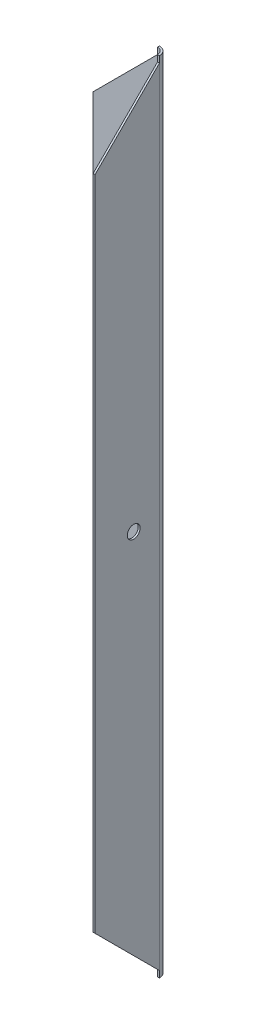
from build123d import *

# Parameters (mm, degrees)
BOSS_EXTRUDE1_DEPTH     = 1.5
BOSS_EXTRUDE3_DEPTH     = 1.5
CUT_EXTRUDE1_DEPTH      = 625.993799969
CUT_EXTRUDE1_DEPTH_BACK = 625.993799969
BOSS_EXTRUDE4_DEPTH     = 620
CUT_EXTRUDE2_DEPTH      = 321.132004023
CUT_EXTRUDE2_DEPTH_BACK = 321.132004023
SKETCH6_R               = 5
CUT_EXTRUDE3_DEPTH      = 320.870676993
CUT_EXTRUDE3_DEPTH_BACK = 320.870676993
SKETCH7_R               = 5


with BuildPart() as part:
    # Sketch1 → Boss-Extrude1 (new body)
    with BuildSketch(Plane(origin=(0, 0, 0), x_dir=(0, 0, -1), z_dir=(1, 0, 0))):
        Polygon((0, -255), (55, -310), (56.5, -310), (56.5, 310), (55, 310), (0, 255), align=None)
    extrude(amount=BOSS_EXTRUDE1_DEPTH)

    # Sketch2 → Boss-Extrude3 (add)
    with BuildSketch(Plane(origin=(0, 0, -56.5), x_dir=(-1, 0, 0), z_dir=(0, 0, -1))):
        Polygon((55, 255), (55, -255), (0, -310), (0, 310), align=None)
    extrude(amount=-BOSS_EXTRUDE3_DEPTH)

    # Sketch5 → Cut-Extrude1 (cut, two sides: drawn at the far end of the back side and taken through both)
    with BuildSketch(Plane.XZ.offset(310).offset(-CUT_EXTRUDE1_DEPTH_BACK)):
        with BuildLine():
            ThreePointArc((1.5, -50), (-0.403805922, -54.596194078), (-5, -56.5))
            Line((-5, -56.5), (1.5, -56.5))
            Line((1.5, -56.5), (1.5, -50))
        make_face()
    extrude(amount=CUT_EXTRUDE1_DEPTH + CUT_EXTRUDE1_DEPTH_BACK, mode=Mode.SUBTRACT)


with BuildPart() as cut_extrude1_piece_1:
    # of the separate pieces the step leaves, piece 1, a body of its own (cut_extrude1_pieces)
    add(part.part.solids().sort_by_distance((-0.846688069, 309.153311931, -55))[0])



with BuildPart() as cut_extrude1_piece_2:
    # of the separate pieces the step leaves, piece 2, a body of its own (cut_extrude1_pieces)
    add(part.part.solids().sort_by_distance((0, 255, 0))[0])


with BuildPart() as cut_extrude1_piece_1_1:
    add(cut_extrude1_piece_1.part)

    add(cut_extrude1_piece_2.part)  # Boss-Extrude4 merges Cut-Extrude1 piece 2
    # Sketch5<3> → Boss-Extrude4 (add)
    with BuildSketch(Plane.XZ.offset(310)):
        with BuildLine():
            ThreePointArc((0, -50), (-1.464466094, -53.535533906), (-5, -55))
            Line((-5, -55), (-5, -56.5))
            ThreePointArc((-5, -56.5), (-0.403805922, -54.596194078), (1.5, -50))
            Line((1.5, -50), (0, -50))
        make_face()
    extrude(amount=-BOSS_EXTRUDE4_DEPTH)

    # Sketch6 → Cut-Extrude2 (cut, two sides: drawn at the far end of the back side and taken through both)
    with BuildSketch(Plane(origin=(1.5, 0, 0), x_dir=(0, 0, -1), z_dir=(1, 0, 0)).offset(-CUT_EXTRUDE2_DEPTH_BACK)):
        with Locations((30, 0)):
            Circle(SKETCH6_R)
    extrude(amount=CUT_EXTRUDE2_DEPTH + CUT_EXTRUDE2_DEPTH_BACK, mode=Mode.SUBTRACT)

    # Sketch7 → Cut-Extrude3 (cut, two sides: drawn at the far end of the back side and taken through both)
    with BuildSketch(Plane(origin=(0, 0, -56.5), x_dir=(-1, 0, 0), z_dir=(0, 0, -1)).offset(-CUT_EXTRUDE3_DEPTH_BACK)):
        with Locations((25, 0)):
            Circle(SKETCH7_R)
    extrude(amount=CUT_EXTRUDE3_DEPTH + CUT_EXTRUDE3_DEPTH_BACK, mode=Mode.SUBTRACT)


solid = cut_extrude1_piece_1_1.part
